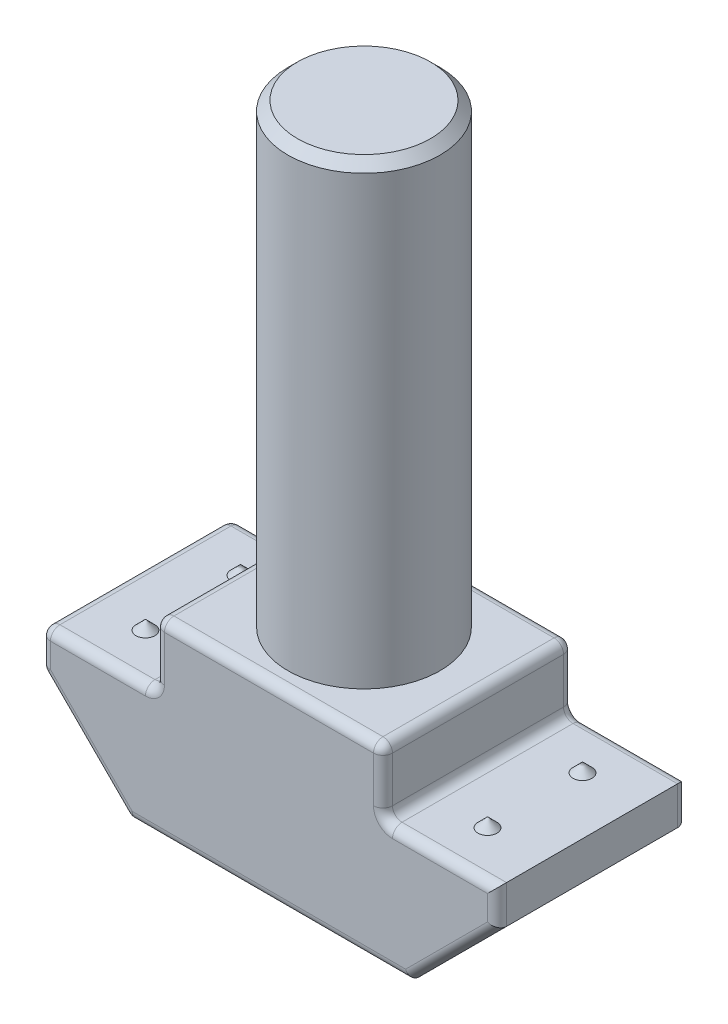
from build123d import *

# Parameters (mm, degrees)
ESTRUSIONE_ESTRUSIONE1_DEPTH = 5
RACCORDO1_R                  = 0.25
SCHIZZO7_R                   = 2
ESTRUSIONE_ESTRUSIONE3_DEPTH = 12
SMUSSO1_SIZE                 = 0.25


with BuildPart() as part:
    # Schizzo1 → Estrusione-Estrusione1 (new body)
    with BuildSketch(Plane.XY):
        Polygon((3.7, 0), (-3.7, 0), (-6, 2.3), (-6, 3.3), (-3, 3.3), (-3, 5), (3, 5), (3, 3.3), (6, 3.3), (6, 2.3), align=None)
    extrude(amount=ESTRUSIONE_ESTRUSIONE1_DEPTH)

    # Raccordo1
    raccordo1_edges = [part.edges().sort_by_distance(p)[0] for p in [
        (3, 3.3, 2.5),
        (3, 5, 2.5),
        (-4.5, 3.3, 5),
        (0, 5, 5),
        (3, 4.15, 5),
        (4.5, 3.3, 5),
        (6, 2.8, 5),
        (4.85, 1.15, 5),
        (0, 0, 5),
        (-3, 5, 2.5),
        (-3, 4.15, 5),
        (-3, 3.3, 2.5),
        (-6, 3.3, 2.5),
        (-6, 2.8, 5),
        (-6, 2.3, 2.5),
        (-4.85, 1.15, 5),
        (-3.7, 0, 2.5),
        (0, 0, 0),
        (4.85, 1.15, 0),
        (6, 2.8, 0),
        (4.5, 3.3, 0),
        (3, 4.15, 0),
        (0, 5, 0),
        (-3, 4.15, 0),
        (-4.5, 3.3, 0),
        (-6, 2.8, 0),
        (-4.85, 1.15, 0),
    ]]
    fillet(raccordo1_edges, radius=RACCORDO1_R)

    # Schizzo7 → Estrusione-Estrusione3 (add)
    with BuildSketch(Plane(origin=(0, 5, 0), x_dir=(1, 0, 0), z_dir=(0, 1, 0))):
        with Locations((0, -2.5)):
            Circle(SCHIZZO7_R)
    extrude(amount=ESTRUSIONE_ESTRUSIONE3_DEPTH)

    # Smusso1
    smusso1_edges = [part.edges().sort_by_distance(p)[0] for p in [
        (-2, 17, 2.5),
    ]]
    chamfer(smusso1_edges, length=SMUSSO1_SIZE)

    # Schizzo8 → Rivoluzione2 (revolve)
    with BuildSketch(Plane.XY.offset(1.25)):
        Polygon((-4.5, 3.3), (-4.5, 3.55), (-4.75, 3.3), align=None)
    rivoluzione2 = revolve(axis=Axis((-4.5, 3.3, 1.25), (0, 1, 0)))

    # Specchia3: Rivoluzione2 across plane
    add(rivoluzione2.mirror(Plane(origin=(0, 0, 0), x_dir=(0, 0, 1), z_dir=(1, 0, 0))))

    # Specchia4 copy 1 sketch → Specchia4 copy 1 (revolve)
    with BuildSketch(Plane(origin=(0, 0, 3.75), x_dir=(-1, 0, 0), z_dir=(0, 0, -1))):
        Polygon((-4.5, 3.3), (-4.5, 3.55), (-4.75, 3.3), align=None)
    revolve(axis=Axis((4.5, 3.3, 3.75), (0, 1, 0)))

    # Specchia4 copy 2 sketch → Specchia4 copy 2 (revolve)
    with BuildSketch(Plane(origin=(0, 0, 3.75), x_dir=(1, 0, 0), z_dir=(0, 0, -1))):
        Polygon((-4.5, -3.3), (-4.5, -3.55), (-4.75, -3.3), align=None)
    revolve(axis=Axis((-4.5, 3.3, 3.75), (0, -1, 0)))


solid = part.part
